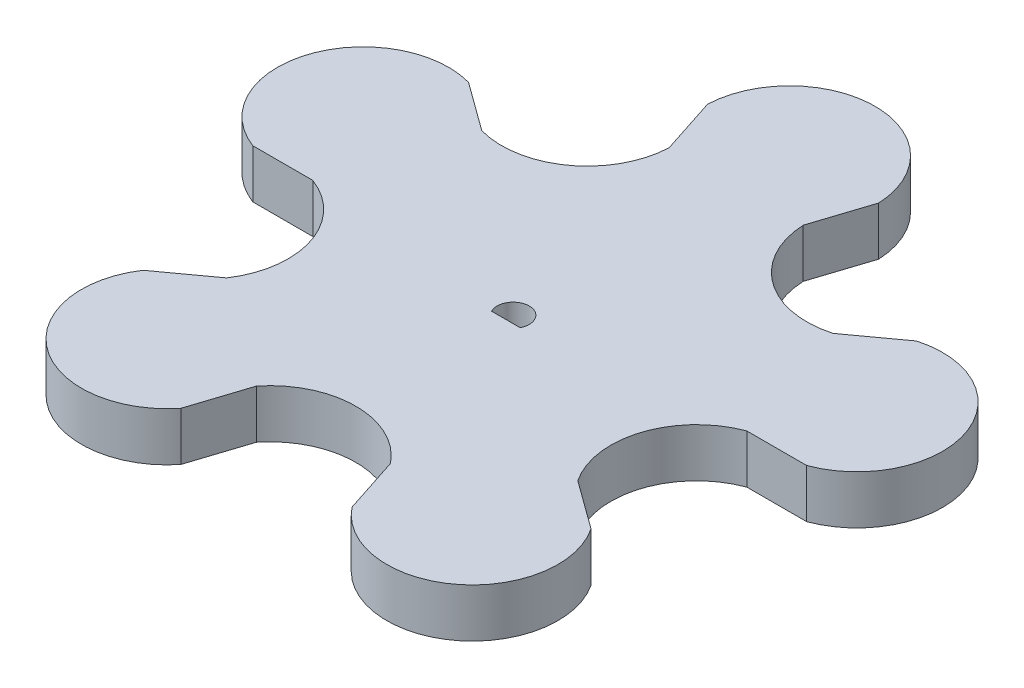
from build123d import *

# Parameters (mm, degrees)
BOSS_EXTRUDE1_DEPTH = 3.175
CUT_EXTRUDE1_DEPTH  = 46.155334956


with BuildPart() as part:
    # Sketch2 → Boss-Extrude1 (new body)
    with BuildSketch(Plane(origin=(0, 0, 0), x_dir=(1, 0, 0), z_dir=(0, 1, 0))):
        with BuildLine():
            ThreePointArc((5.582827527, 34.123976372), (0, 39.4716), (-5.582827527, 34.123976372))
            Line((-5.582827527, 34.123976372), (-4.37531266, 30.407627744))
            ThreePointArc((-4.37531266, 30.407627744), (-6.673596197, 26.127217151), (-11.454717255, 25.264139232))
            Line((-11.454717255, 25.264139232), (-14.61603222, 27.560968998))
            ThreePointArc((-14.61603222, 27.560968998), (-21.427113101, 23.90389108), (-18.066409385, 16.9418))
            Line((-18.066409385, 16.9418), (-14.15880919, 16.9418))
            ThreePointArc((-14.15880919, 16.9418), (-10.798105475, 13.433282849), (-11.454717255, 8.619460768))
            Line((-11.454717255, 8.619460768), (-14.61603222, 6.322631002))
            ThreePointArc((-14.61603222, 6.322631002), (-13.242684177, -1.28519108), (-5.582827527, -0.240376372))
            Line((-5.582827527, -0.240376372), (-4.37531266, 3.475972256))
            ThreePointArc((-4.37531266, 3.475972256), (0, 5.588), (4.37531266, 3.475972256))
            Line((4.37531266, 3.475972256), (5.582827527, -0.240376372))
            ThreePointArc((5.582827527, -0.240376372), (13.242684177, -1.28519108), (14.61603222, 6.322631002))
            Line((14.61603222, 6.322631002), (11.454717255, 8.619460768))
            ThreePointArc((11.454717255, 8.619460768), (10.798105475, 13.433282849), (14.15880919, 16.9418))
            Line((14.15880919, 16.9418), (18.066409385, 16.9418))
            ThreePointArc((18.066409385, 16.9418), (21.427113101, 23.90389108), (14.61603222, 27.560968998))
            Line((14.61603222, 27.560968998), (11.454717255, 25.264139232))
            ThreePointArc((11.454717255, 25.264139232), (6.673596197, 26.127217151), (4.37531266, 30.407627744))
            Line((4.37531266, 30.407627744), (5.582827527, 34.123976372))
        make_face()
    extrude(amount=BOSS_EXTRUDE1_DEPTH)

    # Sketch3 → Cut-Extrude1 (cut, through all)
    with BuildSketch(Plane(origin=(0, 3.175, 0), x_dir=(1, 0, 0), z_dir=(0, 1, 0))):
        with BuildLine():
            Line((-0.933255592, 15.381358575), (0.933255592, 15.381358575))
            ThreePointArc((0.933255592, 15.381358575), (0, 16.905358575), (-0.933255592, 15.381358575))
        make_face()
    extrude(amount=-CUT_EXTRUDE1_DEPTH, mode=Mode.SUBTRACT)


solid = part.part
